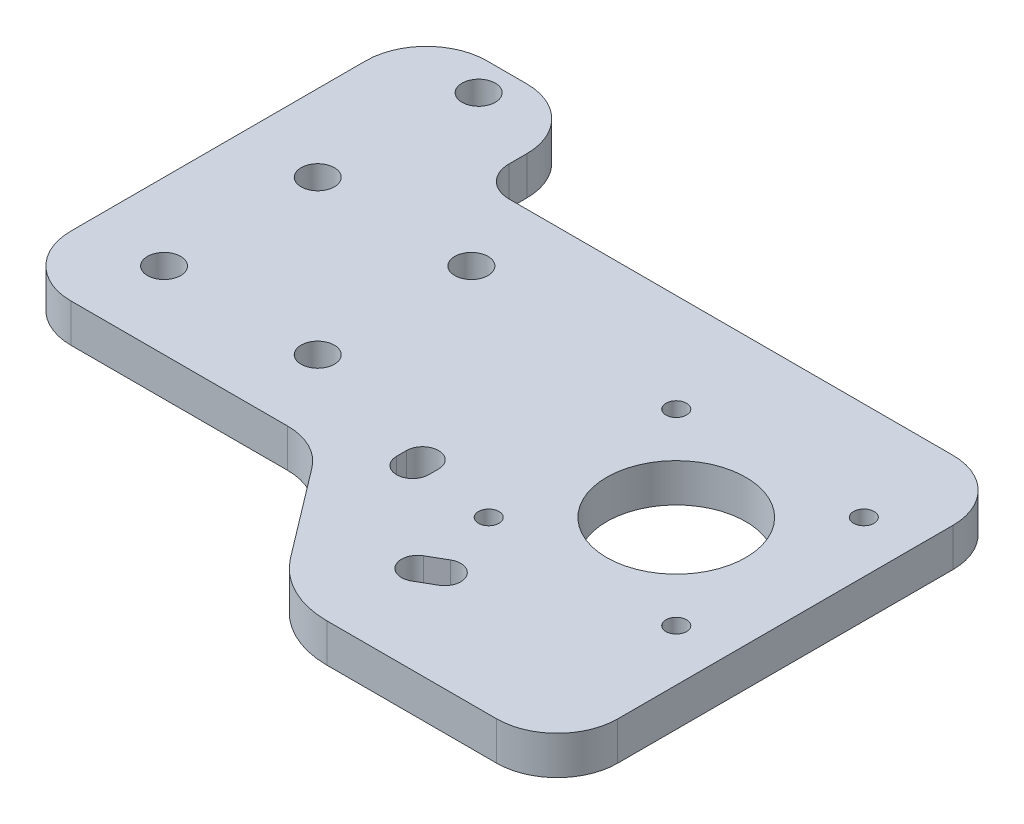
from build123d import *

# Parameters (mm, degrees)
BOSS_EXTRUDE1_DEPTH  = 6.35
M5_CLEARANCE_HOLE1_D = 5.5
CUT_EXTRUDE2_DEPTH   = 103.841068434
FILLET1_R            = 10
M3_CLEARANCE_HOLE1_D = 3.4
SKETCH10_R           = 11.5
CUT_EXTRUDE3_DEPTH   = 103.841068434
FILLET2_R            = 5


with BuildPart() as part:
    # Sketch1 → Boss-Extrude1 (new body)
    with BuildSketch(Plane(origin=(0, 0, 0), x_dir=(1, 0, 0), z_dir=(0, 1, 0))):
        with BuildLine():
            Line((25.4, -25.4), (-25.4, -25.4))
            Line((-25.4, -25.4), (-25.4, 25.4))
            Line((-25.4, 25.4), (-25.4, 43.35))
            Line((-25.4, 43.35), (1.2, 43.35))
            Line((1.2, 43.35), (1.2, 25.4))
            Line((1.2, 25.4), (25.4, 25.4))
            Line((25.4, 25.4), (89.621209859, 25.4))
            Line((89.621209859, 25.4), (89.621209859, -50.04))
            Line((89.621209859, -50.04), (51.541941751, -50.04))
            ThreePointArc((51.541941751, -50.04), (44.870841587, -48.474895705), (39.591870426, -44.10618968))
            Line((39.591870426, -44.10618968), (25.4, -25.4))
        make_face()
    extrude(amount=BOSS_EXTRUDE1_DEPTH)

    # M5 Clearance Hole1 (through all)
    with Locations(Plane(origin=(0, 6.35, 0), x_dir=(1, 0, 0), z_dir=(0, 1, 0))):
        with Locations((-12.7, 12.7), (12.7, 12.7), (12.7, -12.7), (-12.7, -12.7), (-11.5, 38.1)):
            Hole(M5_CLEARANCE_HOLE1_D / 2)

    # Sketch7 → Cut-Extrude2 (cut, through all)
    with BuildSketch(Plane(origin=(0, 6.35, 0), x_dir=(1, 0, 0), z_dir=(0, 1, 0))):
        with BuildLine():
            Line((53.051764766, -31.105892862), (50.215452987, -32.745892862))
            ThreePointArc((50.215452987, -32.745892862), (49.247834614, -36.366488764), (52.868430515, -37.334107138))
            Line((52.868430515, -37.334107138), (55.704742294, -35.694107138))
            ThreePointArc((55.704742294, -35.694107138), (56.672360668, -32.073511236), (53.051764766, -31.105892862))
        make_face()
        with BuildLine():
            Line((33.75, -19.08), (33.75, -20.72))
            ThreePointArc((33.75, -20.72), (36.4, -23.37), (39.05, -20.72))
            Line((39.05, -20.72), (39.05, -19.08))
            ThreePointArc((39.05, -19.08), (36.4, -16.43), (33.75, -19.08))
        make_face()
    extrude(amount=-CUT_EXTRUDE2_DEPTH, mode=Mode.SUBTRACT)

    # Fillet1
    fillet1_edges = [part.edges().sort_by_distance(p)[0] for p in [
        (89.621209859, 3.175, 50.04),
        (89.621209859, 3.175, -25.4),
        (25.4, 3.175, 25.4),
        (-25.4, 3.175, 25.4),
        (-25.4, 3.175, -43.35),
        (1.2, 3.175, -43.35),
    ]]
    fillet(fillet1_edges, radius=FILLET1_R)

    # M3 Clearance Hole1 (through all)
    with Locations(Plane(origin=(0, 6.35, 0), x_dir=(1, 0, 0), z_dir=(0, 1, 0))):
        with Locations((50.121209859, 9.14), (81.121209859, 9.14), (81.121209859, -21.86), (50.121209859, -21.86)):
            Hole(M3_CLEARANCE_HOLE1_D / 2)

    # Sketch10 → Cut-Extrude3 (cut, through all)
    with BuildSketch(Plane(origin=(0, 6.35, 0), x_dir=(1, 0, 0), z_dir=(0, 1, 0))):
        with Locations((65.621209859, -6.36)):
            Circle(SKETCH10_R)
    extrude(amount=-CUT_EXTRUDE3_DEPTH, mode=Mode.SUBTRACT)

    # Fillet2
    fillet2_edges = [part.edges().sort_by_distance(p)[0] for p in [
        (1.2, 3.175, -25.4),
    ]]
    fillet(fillet2_edges, radius=FILLET2_R)


solid = part.part
